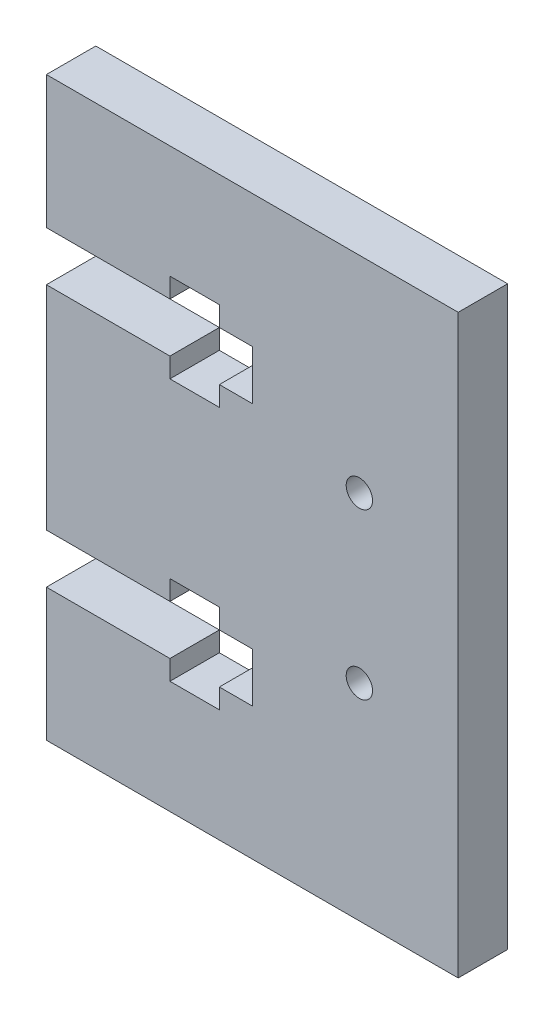
from build123d import *

# Parameters (mm, degrees)
SKETCH1_R           = 1.6
BOSS_EXTRUDE1_DEPTH = 6


with BuildPart() as part:
    # Sketch1 → Boss-Extrude1 (new body)
    with BuildSketch(Plane.XY):
        Polygon((-68, -35), (-118, -35), (-118, -18.9), (-103, -18.9), (-103, -21.3), (-97, -21.3), (-97, -18.9), (-93, -18.9), (-93, -12.9), (-97, -12.9), (-97, -10.5), (-103, -10.5), (-103, -12.9), (-118, -12.9), (-118, 12.9), (-103, 12.9), (-103, 10.5), (-97, 10.5), (-97, 12.9), (-93, 12.9), (-93, 18.9), (-97, 18.9), (-97, 21.3), (-103, 21.3), (-103, 18.9), (-118, 18.9), (-118, 35), (-68, 35), align=None)
        with Locations((-80, -10)):
            Circle(SKETCH1_R, mode=Mode.SUBTRACT)
        with Locations((-80, 10)):
            Circle(SKETCH1_R, mode=Mode.SUBTRACT)
    extrude(amount=BOSS_EXTRUDE1_DEPTH)


solid = part.part
